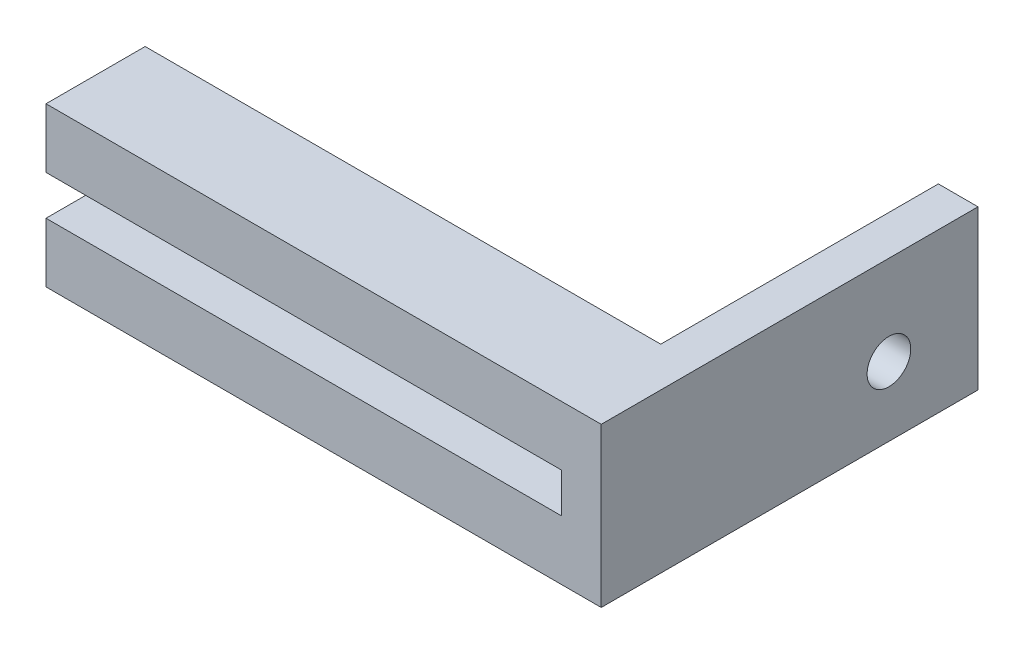
from build123d import *

# Parameters (mm, degrees)
SKETCH1_W           = 95
SKETCH1_H           = 40
BOSS_EXTRUDE1_DEPTH = 10
SKETCH4_W           = 25
SKETCH4_H           = 15
BOSS_EXTRUDE4_DEPTH = 130
SKETCH5_R           = 5.5
CUT_EXTRUDE1_DEPTH  = 27


with BuildPart() as part:
    # Sketch1 → Boss-Extrude1 (new body)
    with BuildSketch(Plane(origin=(0, 0, 0), x_dir=(0, 0, -1), z_dir=(1, 0, 0))):
        with Locations((11.585365854, 0.129573171)):
            Rectangle(SKETCH1_W, SKETCH1_H)
    extrude(amount=BOSS_EXTRUDE1_DEPTH)

    # Sketch4 → Boss-Extrude4 (add)
    with BuildSketch(Plane.ZY):
        with Locations((23.414634146, 12.629573171)):
            Rectangle(SKETCH4_W, SKETCH4_H)
        with Locations((23.414634146, -12.370426829)):
            Rectangle(SKETCH4_W, SKETCH4_H)
    extrude(amount=BOSS_EXTRUDE4_DEPTH)

    # Sketch5 → Cut-Extrude1 (cut)
    with BuildSketch(Plane.ZY):
        with Locations((-36.625365854, -2.430426829)):
            Circle(SKETCH5_R)
    extrude(amount=-CUT_EXTRUDE1_DEPTH, mode=Mode.SUBTRACT)


solid = part.part
